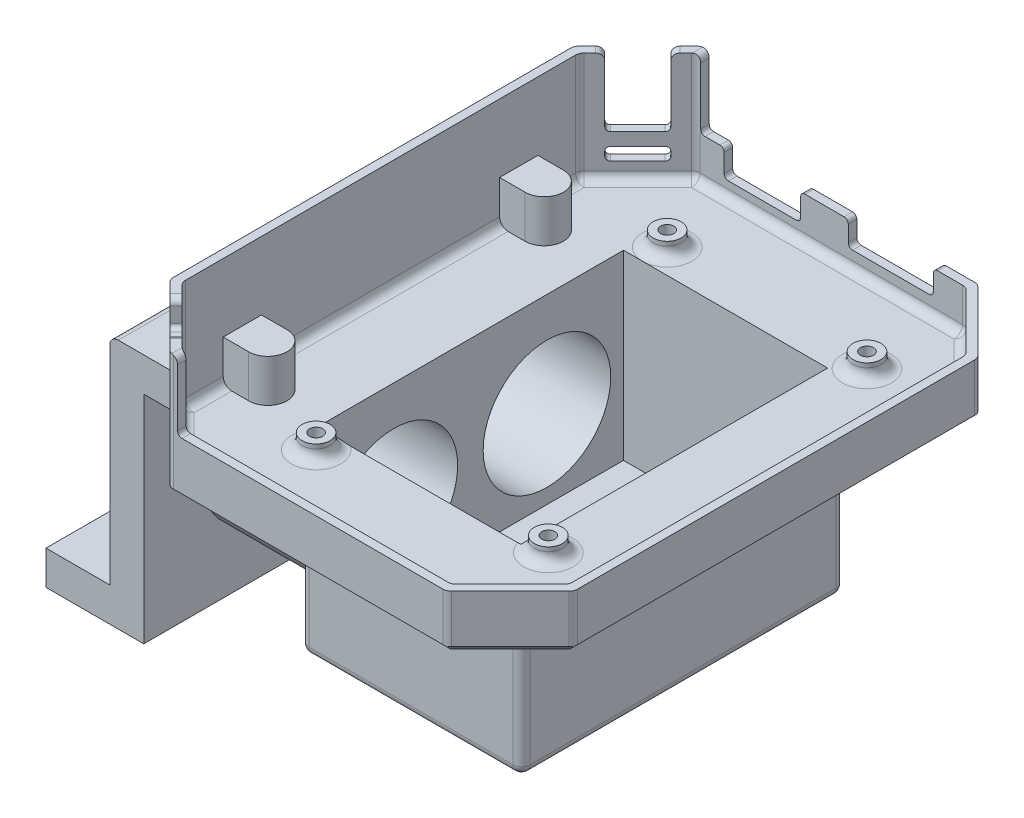
from build123d import *

# Parameters (mm, degrees)
SKICA1_W                   = 95
SKICA1_H                   = 125
P_IDAT_VYSUNUT_M1_DEPTH    = 2.8
ZKOSEN_1_SIZE              = 15
P_IDAT_VYSUNUT_M2_DEPTH    = 10
SKICA3_R                   = 1.55
ODEBRAT_VYSUNUT_M1_DEPTH   = 10
ZKOSEN_2_SIZE              = 1.5
ZAOBLIT1_R                 = 2
P_IDAT_START               = 3.5
SKICA5_R                   = 3.3
SKICA5_R_2                 = 1.55
P_IDAT_VYSUNUT_M3_DEPTH    = 3.5
ZAOBLIT2_R                 = 2.5
ODEBRAT_VYSUNUT_M2_DEPTH   = 2.5
P_IDAT_VYSUNUT_M5_DEPTH    = 16
SKICA11_W                  = 20
SKICA11_H                  = 5.8
SKICA11_W_2                = 18
SKICA11_H_2                = 6.3
ODEBRAT_VYSUNUT_M3_DEPTH   = 10
ZAOBLIT5_R                 = 1
SKICA14_W                  = 11
SKICA14_H                  = 32
SKICA14_H_2                = 3
ODEBRAT_VYSUNUT_M6_DEPTH   = 3.5
SKICA15_W                  = 10
SKICA15_H                  = 12
SKICA15_H_2                = 3
ODEBRAT_VYSUNUT_M7_DEPTH   = 3.5
ZAOBLIT6_R                 = 1
ZAOBLIT8_R                 = 1.5
P_IDAT_VYSUNUT_M10_DEPTH   = 10
P_IDAT_START_2             = -0.2
SKICA29_R                  = 1.55
P_IDAT_VYSUNUT_M14_DEPTH   = 0.2
ESBO_O2_W                  = 48
ESBO_O2_H                  = 72
CORTE_EXTRUS_O1_DEPTH      = 71
ESBO_O3_W                  = 52
ESBO_O3_H                  = 76
ESBO_O3_W_2                = 48
ESBO_O3_H_2                = 72
RESSALTO_EXTRUS_O1_DEPTH   = 40
ESBO_O4_W                  = 52
ESBO_O4_H                  = 76
RESSALTO_EXTRUS_O2_DEPTH   = 3
FILETE1_R                  = 2
ESBO_O7_W                  = 93.34314575
ESBO_O7_H                  = 8
RESSALTO_EXTRUS_O3_DEPTH   = 15
ESBO_O8_W                  = 8
ESBO_O8_H                  = 93.34314575
RESSALTO_EXTRUS_O4_DEPTH   = 50.852603
ESBO_O9_W                  = 93.34314575
ESBO_O9_H                  = 8
RESSALTO_EXTRUS_O5_DEPTH   = 15
ESBO_O10_R                 = 3
CORTE_EXTRUS_O3_DEPTH      = 172.963332503
FILETE2_R                  = 2
CORTE_EXTRUS_O2_DEPTH      = 50
CORTE_EXTRUS_O2_DEPTH_BACK = 10
ESBO_O6_R                  = 15
ESBO_O11_R                 = 17
ESBO_O11_R_2               = 15
RESSALTO_EXTRUS_O6_DEPTH   = 26.38532
FILETE3_R                  = 2


with BuildPart() as part:
    # Skica1 → Přidat vysunutím1 (new body)
    with BuildSketch(Plane(origin=(0, 0, 0), x_dir=(1, 0, 0), z_dir=(0, 1, 0))):
        with Locations((47.5, 62.5)):
            Rectangle(SKICA1_W, SKICA1_H)
    extrude(amount=P_IDAT_VYSUNUT_M1_DEPTH)

    # Zkosení1
    zkosen_1_edges = [part.edges().sort_by_distance(p)[0] for p in [
        (0, 1.4, -125),
        (95, 1.4, -125),
        (95, 1.4, 0),
        (0, 1.4, 0),
    ]]
    chamfer(zkosen_1_edges, length=ZKOSEN_1_SIZE)

    # Skica2 → Přidat vysunutím2 (add)
    with BuildSketch(Plane(origin=(0, 2.8, 0), x_dir=(1, 0, 0), z_dir=(0, 1, 0))):
        Polygon((95, 15), (95, 110), (80, 125), (15, 125), (0, 110), (0, 15), (15, 0), (80, 0), align=None)
        Polygon((93, 15.828427125), (93, 109.171572875), (79.171572875, 123), (15.828427125, 123), (2, 109.171572875), (2, 15.828427125), (15.828427125, 2), (79.171572875, 2), align=None, mode=Mode.SUBTRACT)
    extrude(amount=P_IDAT_VYSUNUT_M2_DEPTH)

    # Skica3 → Odebrat vysunutím1 (cut)
    with BuildSketch(Plane(origin=(0, 2.8, 0), x_dir=(1, 0, 0), z_dir=(0, 1, 0))):
        with Locations(Location((25.87, 106.03, 0), (0, 0, 270))):
            Circle(SKICA3_R)
        with Locations(Location((74.13, 104.76, 0), (0, 0, 270))):
            Circle(SKICA3_R)
        with Locations(Location((74.13, 29.83, 0), (0, 0, 270))):
            Circle(SKICA3_R)
        with Locations(Location((30.95, 53.96, 0), (0, 0, 270))):
            Circle(SKICA3_R)
        with Locations(Location((25.87, 23.48, 0), (0, 0, 270))):
            Circle(SKICA3_R)
    extrude(amount=-ODEBRAT_VYSUNUT_M1_DEPTH, mode=Mode.SUBTRACT)

    # Zkosení2
    zkosen_2_edges = [part.edges().sort_by_distance(p)[0] for p in [
        (47.5, 0, -125),
        (0, 0, -62.5),
        (95, 0, -62.5),
        (47.5, 0, 0),
        (7.5, 0, -117.5),
        (7.5, 0, -7.5),
        (87.5, 0, -7.5),
        (87.5, 0, -117.5),
    ]]
    chamfer(zkosen_2_edges, length=ZKOSEN_2_SIZE)

    # Zaoblit1
    zaoblit1_edges = [part.edges().sort_by_distance(p)[0] for p in [
        (95, 7.15, -110),
        (80, 7.15, 0),
        (0, 7.15, -15),
        (15, 7.15, -125),
        (80, 7.15, -125),
        (95, 7.15, -15),
        (15, 7.15, 0),
        (0, 7.15, -110),
        (86.085786438, 2.8, -8.914213562),
        (93, 2.8, -62.5),
        (86.085786438, 2.8, -116.085786438),
        (47.5, 2.8, -123),
        (8.914213562, 2.8, -116.085786438),
        (2, 2.8, -62.5),
        (8.914213562, 2.8, -8.914213562),
        (47.5, 2.8, -2),
        (93, 7.8, -15.828427125),
        (93, 7.8, -109.171572875),
        (79.171572875, 7.8, -123),
        (15.828427125, 7.8, -123),
        (2, 7.8, -109.171572875),
        (2, 7.8, -15.828427125),
        (15.828427125, 7.8, -2),
        (79.171572875, 7.8, -2),
    ]]
    fillet(zaoblit1_edges, radius=ZAOBLIT1_R)

    # Skica5 → Přidat vysunutím3 (add)
    # profile 1 of 5: a face of its own
    with BuildSketch(Plane(origin=(0, 2.8, 0), x_dir=(1, 0, 0), z_dir=(0, 1, 0)).offset(P_IDAT_START)):
        with Locations(Location((74.13, 29.83, 0), (0, 0, 90))):
            Circle(SKICA5_R)
        with Locations(Location((74.13, 29.83, 0), (0, 0, 270))):
            Circle(SKICA5_R_2, mode=Mode.SUBTRACT)
    # profile 2 of 5: a face of its own
    with BuildSketch(Plane(origin=(0, 2.8, 0), x_dir=(1, 0, 0), z_dir=(0, 1, 0)).offset(P_IDAT_START)):
        with Locations(Location((25.87, 23.48, 0), (0, 0, 90))):
            Circle(SKICA5_R)
        with Locations(Location((25.87, 23.48, 0), (0, 0, 270))):
            Circle(SKICA5_R_2, mode=Mode.SUBTRACT)
    # profile 3 of 5: a face of its own
    with BuildSketch(Plane(origin=(0, 2.8, 0), x_dir=(1, 0, 0), z_dir=(0, 1, 0)).offset(P_IDAT_START)):
        with Locations(Location((30.95, 53.96, 0), (0, 0, 90))):
            Circle(SKICA5_R)
        with Locations(Location((30.95, 53.96, 0), (0, 0, 270))):
            Circle(SKICA5_R_2, mode=Mode.SUBTRACT)
    # profile 4 of 5: a face of its own
    with BuildSketch(Plane(origin=(0, 2.8, 0), x_dir=(1, 0, 0), z_dir=(0, 1, 0)).offset(P_IDAT_START)):
        with Locations(Location((25.87, 106.03, 0), (0, 0, 90))):
            Circle(SKICA5_R)
        with Locations(Location((25.87, 106.03, 0), (0, 0, 270))):
            Circle(SKICA5_R_2, mode=Mode.SUBTRACT)
    # profile 5 of 5: a face of its own
    with BuildSketch(Plane(origin=(0, 2.8, 0), x_dir=(1, 0, 0), z_dir=(0, 1, 0)).offset(P_IDAT_START)):
        with Locations(Location((74.13, 104.76, 0), (0, 0, 90))):
            Circle(SKICA5_R)
        with Locations(Location((74.13, 104.76, 0), (0, 0, 270))):
            Circle(SKICA5_R_2, mode=Mode.SUBTRACT)
    extrude(amount=-P_IDAT_VYSUNUT_M3_DEPTH)

    # Zaoblit2
    zaoblit2_edges = [part.edges().sort_by_distance(p)[0] for p in [
        (74.13, 2.8, -26.53),
        (25.87, 2.8, -20.18),
        (30.95, 2.8, -50.66),
        (25.87, 2.8, -102.73),
        (74.13, 2.8, -101.46),
    ]]
    fillet(zaoblit2_edges, radius=ZAOBLIT2_R)

    # Skica6 → Odebrat vysunutím2 (cut)
    with BuildSketch(Plane.XZ):
        Polygon((75.6311107, -107.36), (77.1322214, -104.76), (75.6311107, -102.16), (72.6288893, -102.16), (71.1277786, -104.76), (72.6288893, -107.36), align=None)
        Polygon((27.3711107, -108.63), (28.8722214, -106.03), (27.3711107, -103.43), (24.3688893, -103.43), (22.8677786, -106.03), (24.3688893, -108.63), align=None)
        Polygon((32.4511107, -56.56), (33.9522214, -53.96), (32.4511107, -51.36), (29.4488893, -51.36), (27.9477786, -53.96), (29.4488893, -56.56), align=None)
        Polygon((27.3711107, -26.08), (28.8722214, -23.48), (27.3711107, -20.88), (24.3688893, -20.88), (22.8677786, -23.48), (24.3688893, -26.08), align=None)
        Polygon((75.6311107, -32.43), (77.1322214, -29.83), (75.6311107, -27.23), (72.6288893, -27.23), (71.1277786, -29.83), (72.6288893, -32.43), align=None)
    extrude(amount=-ODEBRAT_VYSUNUT_M2_DEPTH, mode=Mode.SUBTRACT)

    # Skica8 → Přidat vysunutím5 (add)
    with BuildSketch(Plane(origin=(0, 12.8, 0), x_dir=(1, 0, 0), z_dir=(0, 1, 0))):
        with BuildLine():
            Line((2, 108.343145751), (2, 16.656854249))
            ThreePointArc((2, 16.656854249), (2.152240935, 15.891487385), (2.585786438, 15.242640687))
            Line((2.585786438, 15.242640687), (15.242640687, 2.585786438))
            ThreePointArc((15.242640687, 2.585786438), (15.958145414, 2.126018687), (16.8, 2.005129254))
            Line((16.8, 2.005129254), (16.8, 0))
            Line((16.8, 0), (15.828427125, 0))
            ThreePointArc((15.828427125, 0), (15.06306026, 0.152240935), (14.414213562, 0.585786438))
            Line((14.414213562, 0.585786438), (0.585786438, 14.414213562))
            ThreePointArc((0.585786438, 14.414213562), (0.152240935, 15.06306026), (0, 15.828427125))
            Line((0, 15.828427125), (0, 109.171572875))
            ThreePointArc((0, 109.171572875), (0.152240935, 109.93693974), (0.585786438, 110.585786438))
            Line((0.585786438, 110.585786438), (14.414213562, 124.414213562))
            ThreePointArc((14.414213562, 124.414213562), (15.06306026, 124.847759065), (15.828427125, 125))
            Line((15.828427125, 125), (16.8, 125))
            Line((16.8, 125), (16.8, 123))
            Line((16.8, 123), (16.8, 122.994870746))
            ThreePointArc((16.8, 122.994870746), (15.958145414, 122.873981313), (15.242640687, 122.414213562))
            Line((15.242640687, 122.414213562), (2.585786438, 109.757359313))
            ThreePointArc((2.585786438, 109.757359313), (2.152240935, 109.108512615), (2, 108.343145751))
        make_face()
    extrude(amount=P_IDAT_VYSUNUT_M5_DEPTH)

    # Skica11 → Odebrat vysunutím3 (cut)
    with BuildSketch(Plane(origin=(0, 0, -125), x_dir=(-1, 0, 0), z_dir=(0, 0, -1))):
        with Locations((-61.5, 9.9)):
            Rectangle(SKICA11_W, SKICA11_H)
        with Locations((-31.307, 9.65)):
            Rectangle(SKICA11_W_2, SKICA11_H_2)
    extrude(amount=-ODEBRAT_VYSUNUT_M3_DEPTH, mode=Mode.SUBTRACT)

    # Zaoblit5
    # the kernel refuses this fillet: 1 mm, written as the material it adds along each edge
    with BuildSketch(Plane(origin=(16.8, 12.8, -125), x_dir=(1, 0, 0), z_dir=(0, 0, 1)), Plane(origin=(16.8, 12.8, -2), x_dir=(1, 0, 0), z_dir=(0, 0, 1))) as zaoblit5_piece_1:
        with BuildLine():
            CenterArc((ZAOBLIT5_R, ZAOBLIT5_R), ZAOBLIT5_R, 180, 90)
            Line((0, ZAOBLIT5_R), (0, 0))
            Line((0, 0), (ZAOBLIT5_R, 0))
        make_face()
    extrude(amount=2)
    with BuildSketch(Plane(origin=(71.5, 7, -125), x_dir=(-1, 0, 0), z_dir=(0, 0, 1)), Plane(origin=(51.5, 7, -125), x_dir=(0, 1, 0), z_dir=(0, 0, 1)), Plane(origin=(40.307, 6.5, -125), x_dir=(-1, 0, 0), z_dir=(0, 0, 1)), Plane(origin=(22.307, 6.5, -125), x_dir=(0, 1, 0), z_dir=(0, 0, 1))) as zaoblit5_piece_2:
        with BuildLine():
            CenterArc((ZAOBLIT5_R, -ZAOBLIT5_R), ZAOBLIT5_R, 90, 90)
            Line((0, -ZAOBLIT5_R), (0, 0))
            Line((0, 0), (ZAOBLIT5_R, 0))
        make_face()
    extrude(amount=2)
    # the kernel refuses this fillet: 1 mm, written as the material it takes off along each edge
    with BuildSketch(Plane(origin=(71.5, 12.8, -127.5), x_dir=(0, -1, 0), z_dir=(0, 0, 1)), Plane(origin=(51.5, 12.8, -127.5), x_dir=(-1, 0, 0), z_dir=(0, 0, 1)), Plane(origin=(40.307, 12.8, -127.5), x_dir=(0, -1, 0), z_dir=(0, 0, 1)), Plane(origin=(22.307, 12.8, -127.5), x_dir=(-1, 0, 0), z_dir=(0, 0, 1))) as zaoblit5_2_piece_1:
        with BuildLine():
            CenterArc((ZAOBLIT5_R, ZAOBLIT5_R), ZAOBLIT5_R, 180, 90)
            Line((0, ZAOBLIT5_R), (0, 0))
            Line((0, 0), (ZAOBLIT5_R, 0))
        make_face()
    extrude(amount=7, mode=Mode.SUBTRACT)

    # Skica14 → Odebrat vysunutím6 (cut)
    with BuildSketch(Plane(origin=(-55, 0, -55), x_dir=(-0.7071067811865488, 0, 0.7071067811865464), z_dir=(-0.7071067811865464, 0, -0.7071067811865488))):
        with Locations((-88.388347648, 28.8)):
            Rectangle(SKICA14_W, SKICA14_H)
        with Locations((-88.388347648, 8.3)):
            Rectangle(SKICA14_W, SKICA14_H_2)
    extrude(amount=-ODEBRAT_VYSUNUT_M6_DEPTH, mode=Mode.SUBTRACT)

    # Skica15 → Odebrat vysunutím7 (cut)
    with BuildSketch(Plane(origin=(7.5, 0, -7.5), x_dir=(0.7071067811865464, 0, 0.7071067811865488), z_dir=(-0.7071067811865488, 0, 0.7071067811865464))):
        with Locations((0, 28.8)):
            Rectangle(SKICA15_W, SKICA15_H)
        with Locations((0, 15.3)):
            Rectangle(SKICA15_W, SKICA15_H_2)
    extrude(amount=-ODEBRAT_VYSUNUT_M7_DEPTH, mode=Mode.SUBTRACT)

    # Zaoblit6
    zaoblit6_edges = [part.edges().sort_by_distance(p)[0] for p in [
        (4.318019485, 12.8, -112.903805922),
        (12.096194078, 12.8, -120.681980515),
        (4.318019485, 9.8, -112.903805922),
        (4.318019485, 6.8, -112.903805922),
        (12.096194078, 6.8, -120.681980515),
        (12.096194078, 9.8, -120.681980515),
        (4.671572875, 22.8, -11.742640687),
        (11.742640687, 22.8, -4.671572875),
        (11.742640687, 16.8, -4.671572875),
        (11.742640687, 13.8, -4.671572875),
        (4.671572875, 13.8, -11.742640687),
        (4.671572875, 16.8, -11.742640687),
    ]]
    fillet(zaoblit6_edges, radius=ZAOBLIT6_R)

    # Zaoblit8
    # the kernel refuses this fillet: 1.5 mm, written as the material it takes off along each edge
    with BuildSketch(Plane(origin=(16.8, 28.8, -5.755129254), x_dir=(-1, 0, 0), z_dir=(0, 0, 1))) as zaoblit8_piece_1:
        with BuildLine():
            CenterArc((ZAOBLIT8_R, ZAOBLIT8_R), ZAOBLIT8_R, 180, 90)
            Line((0, ZAOBLIT8_R), (0, 0))
            Line((0, 0), (ZAOBLIT8_R, 0))
        make_face()
    extrude(amount=9.505129254, mode=Mode.SUBTRACT)
    with BuildSketch(Plane(origin=(16.8, 28.8, -128.75), x_dir=(-1, 0, 0), z_dir=(0, 0, 1))) as zaoblit8_piece_2:
        with BuildLine():
            CenterArc((ZAOBLIT8_R, ZAOBLIT8_R), ZAOBLIT8_R, 180, 90)
            Line((0, ZAOBLIT8_R), (0, 0))
            Line((0, 0), (ZAOBLIT8_R, 0))
        make_face()
    extrude(amount=5.75, mode=Mode.SUBTRACT)
    with BuildSketch(Plane(origin=(15.454951288, 28.8, -117.323223305), x_dir=(0, -1, 0), z_dir=(-0.7071067811865464, 0, -0.7071067811865488)), Plane(origin=(0.959262274, 28.8, -116.262563133), x_dir=(0, -1, 0), z_dir=(0.7071067811865464, 0, 0.7071067811865488)), Plane(origin=(8.383883476, 28.8, -1.312815665), x_dir=(0, -1, 0), z_dir=(0.7071067811865488, 0, -0.7071067811865464))) as zaoblit8_piece_3:
        with BuildLine():
            CenterArc((ZAOBLIT8_R, -ZAOBLIT8_R), ZAOBLIT8_R, 90, 90)
            Line((0, -ZAOBLIT8_R), (0, 0))
            Line((0, 0), (ZAOBLIT8_R, 0))
        make_face()
    extrude(amount=9.5, mode=Mode.SUBTRACT)
    with BuildSketch(Plane(origin=(8.030330086, 28.8, -15.101397898), x_dir=(-0.7071067811865464, 0, -0.7071067811865487), z_dir=(-0.7071067811865488, 0, 0.7071067811865464))) as zaoblit8_piece_4:
        with BuildLine():
            CenterArc((ZAOBLIT8_R, ZAOBLIT8_R), ZAOBLIT8_R, 180, 90)
            Line((0, ZAOBLIT8_R), (0, 0))
            Line((0, 0), (ZAOBLIT8_R, 0))
        make_face()
    extrude(amount=9.5, mode=Mode.SUBTRACT)
    with BuildSketch(Plane(origin=(16.8, 28.8, -123), x_dir=(-1.0, 0, -2.0779125944772392e-12), z_dir=(-2.0779125944772392e-12, 0, 1.0))) as zaoblit8_piece_5:
        with BuildLine():
            CenterArc((ZAOBLIT8_R, ZAOBLIT8_R), ZAOBLIT8_R, 180, 90)
            Line((0, ZAOBLIT8_R), (0, 0))
            Line((0, 0), (ZAOBLIT8_R, 0))
        make_face()
    extrude(amount=3.755129254, mode=Mode.SUBTRACT)

    # Skica20 → Přidat vysunutím10 (add)
    with BuildSketch(Plane(origin=(0, 2.8, 0), x_dir=(1, 0, 0), z_dir=(0, 1, 0))):
        with BuildLine():
            Line((8, 34.5), (2, 34.5))
            Line((2, 34.5), (2, 25.5))
            Line((2, 25.5), (8, 25.5))
            ThreePointArc((8, 25.5), (12.5, 30), (8, 34.5))
        make_face()
        with BuildLine():
            Line((8, 99.5), (2, 99.5))
            Line((2, 99.5), (2, 90.5))
            Line((2, 90.5), (8, 90.5))
            ThreePointArc((8, 90.5), (12.5, 95), (8, 99.5))
        make_face()
    extrude(amount=P_IDAT_VYSUNUT_M10_DEPTH)

    # Skica29 → Přidat vysunutím14 (add)
    with BuildSketch(Plane.XZ.offset(-2.5).offset(P_IDAT_START_2)):
        with Locations(Location((25.87, -106.03, 0), (0, 0, 90))):
            Circle(SKICA29_R)
        with Locations(Location((74.13, -104.76, 0), (0, 0, 90))):
            Circle(SKICA29_R)
        with Locations(Location((30.95, -53.96, 0), (0, 0, 90))):
            Circle(SKICA29_R)
        with Locations(Location((74.13, -29.83, 0), (0, 0, 90))):
            Circle(SKICA29_R)
        with Locations(Location((25.87, -23.48, 0), (0, 0, 90))):
            Circle(SKICA29_R)
    extrude(amount=P_IDAT_VYSUNUT_M14_DEPTH)

    # Esboço2 → Corte-extrusão1 (cut)
    with BuildSketch(Plane.XZ):
        with Locations((45.385319517, -64.248503432)):
            Rectangle(ESBO_O2_W, ESBO_O2_H)
    extrude(amount=-CORTE_EXTRUS_O1_DEPTH, mode=Mode.SUBTRACT)

    # Esboço3 → Ressalto-extrusão1 (add)
    with BuildSketch(Plane.XZ):
        with Locations((45.385319517, -64.248503432)):
            Rectangle(ESBO_O3_W, ESBO_O3_H)
        with Locations((45.385319517, -64.248503432)):
            Rectangle(ESBO_O3_W_2, ESBO_O3_H_2, mode=Mode.SUBTRACT)
    extrude(amount=RESSALTO_EXTRUS_O1_DEPTH)

    # Esboço4 → Ressalto-extrusão2 (add)
    with BuildSketch(Plane.XZ.offset(40)):
        with Locations((45.385319517, -64.248503432)):
            Rectangle(ESBO_O4_W, ESBO_O4_H)
    extrude(amount=RESSALTO_EXTRUS_O2_DEPTH)

    # Filete1
    filete1_edges = [part.edges().sort_by_distance(p)[0] for p in [
        (71.385319517, -21.5, -102.248503432),
        (71.385319517, -21.5, -26.248503432),
        (19.385319517, -21.5, -26.248503432),
        (19.385319517, -21.5, -102.248503432),
        (45.385319517, -43, -102.248503432),
        (71.385319517, -43, -64.248503432),
        (45.385319517, -43, -26.248503432),
        (19.385319517, -43, -64.248503432),
    ]]
    fillet(filete1_edges, radius=FILETE1_R)

    # Esboço7 → Ressalto-extrusão3 (add)
    with BuildSketch(Plane.ZY):
        with Locations((-62.5, 5.5)):
            Rectangle(ESBO_O7_W, ESBO_O7_H)
    extrude(amount=RESSALTO_EXTRUS_O3_DEPTH)

    # Esboço8 → Ressalto-extrusão4 (add)
    with BuildSketch(Plane.XZ.offset(-1.5)):
        with Locations((-11, -62.5)):
            Rectangle(ESBO_O8_W, ESBO_O8_H)
    extrude(amount=RESSALTO_EXTRUS_O4_DEPTH)

    # Esboço9 → Ressalto-extrusão5 (add)
    with BuildSketch(Plane.ZY.offset(15)):
        with Locations((-62.5, -45.352602848)):
            Rectangle(ESBO_O9_W, ESBO_O9_H)
    extrude(amount=RESSALTO_EXTRUS_O5_DEPTH)

    # Esboço10 → Corte-extrusão3 (cut, through all)
    with BuildSketch(Plane(origin=(0, -41.352602848, 0), x_dir=(1, 0, 0), z_dir=(0, 1, 0))):
        with Locations(Location((-22.5, 94.171572875, 0), (0, 0, 270))):
            Circle(ESBO_O10_R)
        with Locations(Location((-22.5, 30.828427125, 0), (0, 0, 270))):
            Circle(ESBO_O10_R)
    extrude(amount=-CORTE_EXTRUS_O3_DEPTH, mode=Mode.SUBTRACT)

    # Filete2
    filete2_edges = [part.edges().sort_by_distance(p)[0] for p in [
        (-15, 9.5, -62.5),
    ]]
    fillet(filete2_edges, radius=FILETE2_R)

    # Esboço6 → Corte-extrusão2 (cut, two sides: drawn at the far end of the back side and taken through both)
    with BuildSketch(Plane.ZY.offset(-19.385319517).offset(-CORTE_EXTRUS_O2_DEPTH_BACK)):
        with Locations(Location((-46.248503432, -21.5, 0), (0, 0, 180))):
            Circle(ESBO_O6_R)
        with Locations(Location((-82.248503432, -21.5, 0), (0, 0, 180))):
            Circle(ESBO_O6_R)
    extrude(amount=CORTE_EXTRUS_O2_DEPTH + CORTE_EXTRUS_O2_DEPTH_BACK, mode=Mode.SUBTRACT)

    # Esboço11 → Ressalto-extrusão6 (add)
    # profile 1 of 2: a face of its own
    with BuildSketch(Plane.ZY.offset(-19.385319517)):
        with Locations(Location((-46.248503432, -21.5, 0), (0, 0, 180))):
            Circle(ESBO_O11_R)
        with Locations(Location((-46.248503432, -21.5, 0), (0, 0, 180))):
            Circle(ESBO_O11_R_2, mode=Mode.SUBTRACT)
    # profile 2 of 2: a face of its own
    with BuildSketch(Plane.ZY.offset(-19.385319517)):
        with Locations(Location((-82.248503432, -21.5, 0), (0, 0, 180))):
            Circle(ESBO_O11_R)
        with Locations(Location((-82.248503432, -21.5, 0), (0, 0, 180))):
            Circle(ESBO_O11_R_2, mode=Mode.SUBTRACT)
    extrude(amount=RESSALTO_EXTRUS_O6_DEPTH)

    # Filete3
    filete3_edges = [part.edges().sort_by_distance(p)[0] for p in [
        (-15, -21.5, -67.248503432),
        (-15, -21.5, -31.248503432),
    ]]
    fillet(filete3_edges, radius=FILETE3_R)


solid = part.part
